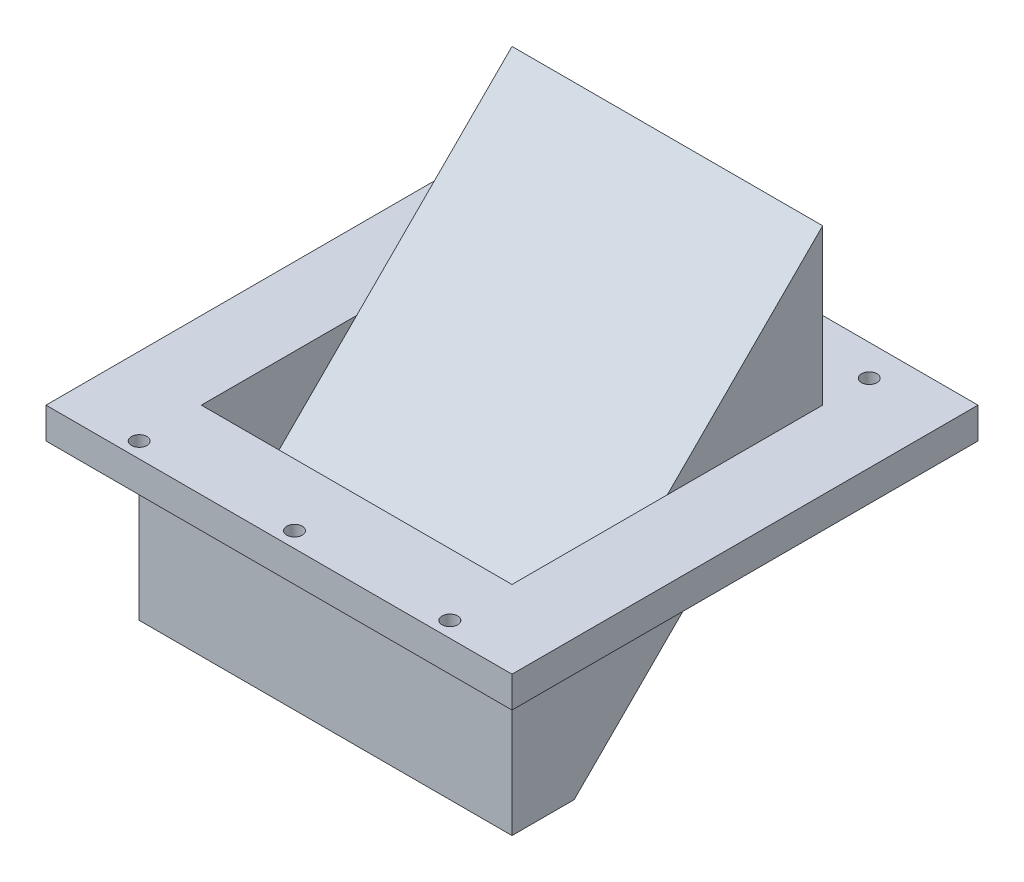
from build123d import *

# Parameters (mm, degrees)
SKETCH1_W           = 150
SKETCH1_H           = 150
BOSS_EXTRUDE1_DEPTH = 10
SKETCH3_W           = 100
SKETCH3_H           = 50
BOSS_EXTRUDE2_DEPTH = 50
CUT_EXTRUDE1_DEPTH  = 205.266982158
SKETCH5_W           = 100
SKETCH5_H           = 50
CUT_EXTRUDE2_DEPTH  = 218.944947177
SKETCH7_W           = 120
SKETCH7_H           = 70
BOSS_EXTRUDE6_DEPTH = 50
BOSS_EXTRUDE7_DEPTH = 100
SKETCH9_W           = 100
SKETCH9_H           = 40
CUT_EXTRUDE4_DEPTH  = 40
BOSS_EXTRUDE8_DEPTH = 100
CUT_EXTRUDE5_DEPTH  = 211.535032714
SHELL1_START        = 35
SHELL1_DEPTH        = 80
SKETCH12_R          = 2.5
CUT_EXTRUDE6_DEPTH  = 221.45407685


# Read off the part's stored shape, not the designer's step: Shell1
with BuildPart() as part:
    # Sketch1 → Boss-Extrude1 (new body)
    with BuildSketch(Plane(origin=(0, 0, 0), x_dir=(1, 0, 0), z_dir=(0, 1, 0))):
        with Locations((75, 75)):
            Rectangle(SKETCH1_W, SKETCH1_H)
    extrude(amount=BOSS_EXTRUDE1_DEPTH)

    # Sketch3 → Boss-Extrude2 (add)
    with BuildSketch(Plane(origin=(0, 10, 0), x_dir=(1, 0, 0), z_dir=(0, 1, 0))):
        with Locations((75, 100)):
            Rectangle(SKETCH3_W, SKETCH3_H)
    extrude(amount=BOSS_EXTRUDE2_DEPTH)

    # Sketch4 → Cut-Extrude1 (cut, through all)
    with BuildSketch(Plane.ZY.offset(-25)):
        Polygon((-125, 60), (-75, 10), (-75, 60), align=None)
    extrude(amount=-CUT_EXTRUDE1_DEPTH, mode=Mode.SUBTRACT)

    # Sketch5 → Cut-Extrude2 (cut, through all)
    with BuildSketch(Plane(origin=(0, 10, 0), x_dir=(1, 0, 0), z_dir=(0, 1, 0))):
        with Locations((75, 50)):
            Rectangle(SKETCH5_W, SKETCH5_H)
    extrude(amount=-CUT_EXTRUDE2_DEPTH, mode=Mode.SUBTRACT)

    # Sketch7 → Boss-Extrude6 (add)
    with BuildSketch(Plane.XZ):
        with Locations((75, -50)):
            Rectangle(SKETCH7_W, SKETCH7_H)
    extrude(amount=BOSS_EXTRUDE6_DEPTH)

    # Sketch6 → Boss-Extrude7 (add)
    with BuildSketch(Plane(origin=(25, 0, 0), x_dir=(0, 0, -1), z_dir=(1, 0, 0))):
        Polygon((75, 0), (75, 10), (65, 0), align=None)
    extrude(amount=BOSS_EXTRUDE7_DEPTH)

    # Sketch9 → Cut-Extrude4 (cut)
    with BuildSketch(Plane(origin=(0, 0, 0), x_dir=(1, 0, 0), z_dir=(0, 1, 0))):
        with Locations((75, 45)):
            Rectangle(SKETCH9_W, SKETCH9_H)
    extrude(amount=-CUT_EXTRUDE4_DEPTH, mode=Mode.SUBTRACT)

    # Sketch10 → Boss-Extrude8 (add)
    with BuildSketch(Plane(origin=(25, 0, 0), x_dir=(0, 0, -1), z_dir=(1, 0, 0))):
        Polygon((65, 0), (25, -40), (65, -40), align=None)
    extrude(amount=BOSS_EXTRUDE8_DEPTH)

    # Sketch11 → Cut-Extrude5 (cut, through all)
    with BuildSketch(Plane(origin=(135, 0, 0), x_dir=(0, 0, -1), z_dir=(1, 0, 0))):
        Polygon((85, 0), (85, -50), (35, -50), align=None)
    extrude(amount=-CUT_EXTRUDE5_DEPTH, mode=Mode.SUBTRACT)

    # Shell1 outline → Shell1 (cut)
    with BuildSketch(Plane.YZ.offset(SHELL1_START)):
        Polygon((45.857864376, -125), (10, -89.142135624), (10, -125), align=None)
    extrude(amount=SHELL1_DEPTH, mode=Mode.SUBTRACT)

    # Sketch12 → Cut-Extrude6 (cut, through all)
    with BuildSketch(Plane.XZ):
        with Locations(Location((125, -140, 0), (0, 0, 270))):
            Circle(SKETCH12_R)
        with Locations(Location((75, -140, 0), (0, 0, 270))):
            Circle(SKETCH12_R)
        with Locations(Location((25, -140, 0), (0, 0, 270))):
            Circle(SKETCH12_R)
        with Locations(Location((125, -5, 0), (0, 0, 270))):
            Circle(SKETCH12_R)
        with Locations(Location((75, -5, 0), (0, 0, 270))):
            Circle(SKETCH12_R)
        with Locations(Location((25, -5, 0), (0, 0, 270))):
            Circle(SKETCH12_R)
    extrude(amount=-CUT_EXTRUDE6_DEPTH, mode=Mode.SUBTRACT)


solid = part.part
